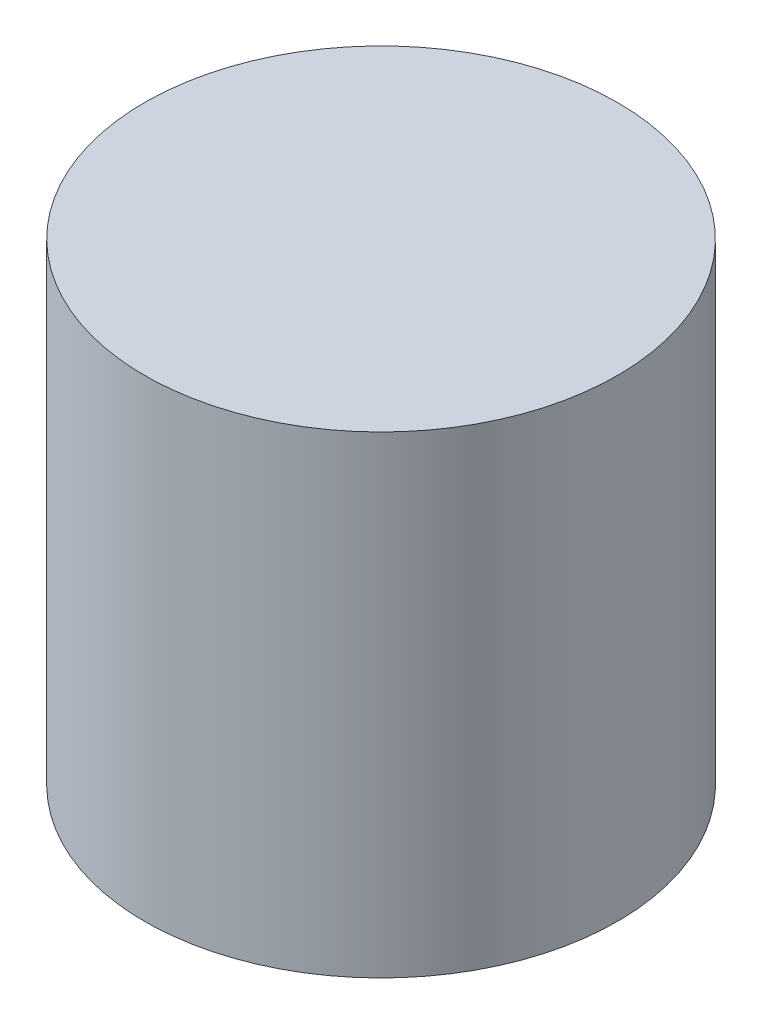
from build123d import *

# Parameters (mm, degrees)
SKETCH1_R           = 38.1
BOSS_EXTRUDE1_DEPTH = 76.2
SHELL1_T            = 6.35
CUT_EXTRUDE1_REACH  = 95.326
SKETCH2_R           = 9.525


with BuildPart() as part:
    # Sketch1 → Boss-Extrude1 (new body)
    with BuildSketch(Plane(origin=(0, 0, 0), x_dir=(1, 0, 0), z_dir=(0, 1, 0))):
        Circle(SKETCH1_R)
    extrude(amount=BOSS_EXTRUDE1_DEPTH)

    # Shell1 (no face opened: a closed hollow body)
    add(offset(amount=-SHELL1_T, mode=Mode.PRIVATE), mode=Mode.SUBTRACT)

    # Sketch2 → Cut-Extrude1 (cut, up to next)
    with BuildSketch(Plane.XZ, mode=Mode.PRIVATE) as cut_extrude1_sk1:
        Circle(SKETCH2_R)
    cut_extrude1_tool1 = extrude(cut_extrude1_sk1.sketch, amount=-CUT_EXTRUDE1_REACH, mode=Mode.PRIVATE) & part.part
    add(cut_extrude1_tool1.solids().sort_by_distance((0, 0, 0))[0], mode=Mode.SUBTRACT)


solid = part.part
